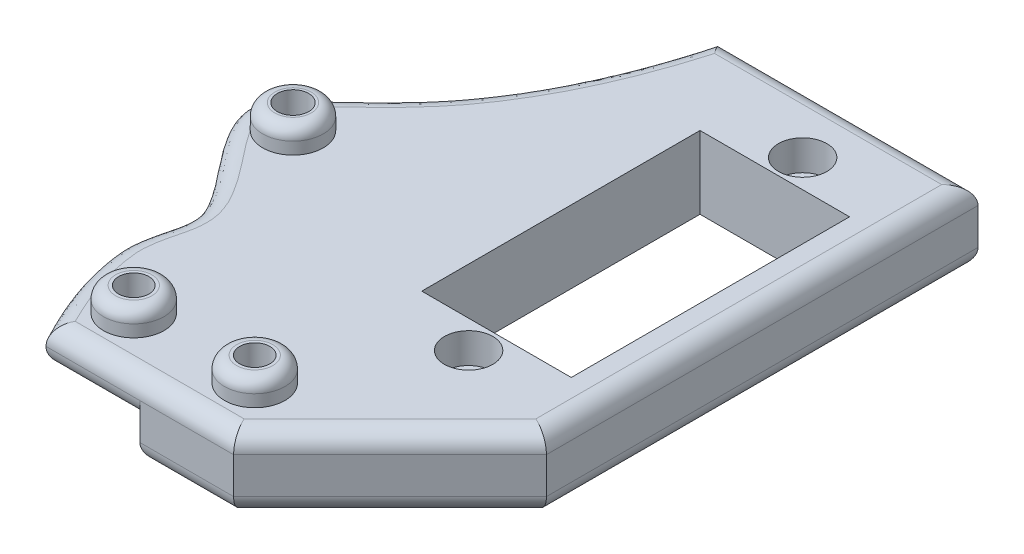
from build123d import *

# Parameters (mm, degrees)
BOSS_EXTRUDE1_DEPTH        = 3
SKETCH2_W                  = 12.36
SKETCH2_H                  = 23
CUT_EXTRUDE1_DEPTH         = 33.919797
F_2_6_2_6_DIAMETER_HOLE1_D = 2.6
F_2_0_2_DIAMETER_HOLE1_D   = 2
F_2_2_2_2_DIAMETER_HOLE1_D = 2.2
BOSS_EXTRUDE2_DEPTH        = 3
SKETCH11_W                 = 12.36
SKETCH11_H                 = 23
CUT_EXTRUDE2_DEPTH         = 34.327361
SKETCH12_R                 = 1
SKETCH12_R_2               = 1.1
CUT_EXTRUDE3_DEPTH         = 34.327361
SKETCH13_R                 = 2
CUT_EXTRUDE4_DEPTH         = 2.5
FILLET3_R                  = 1.5
SKETCH14_R                 = 1.25
CUT_EXTRUDE5_DEPTH         = 34.327361
BOSS_EXTRUDE3_START        = 2
SKETCH15_R                 = 2.5
SKETCH15_R_2               = 1.25
SKETCH15_R_3               = 1.3
BOSS_EXTRUDE3_DEPTH        = 2
FILLET4_R                  = 1


with BuildPart() as part:
    # Sketch1 → Boss-Extrude1 (new body)
    with BuildSketch(Plane.XZ.offset(3)):
        with BuildLine():
            Line((-0.726337, -25.437189), (20.68, -25.437189))
            Line((20.68, -25.437189), (20.68, 10.235728))
            Line((20.68, 10.235728), (7.753398, 23.162329))
            Line((7.753398, 23.162329), (-7.753398, 23.162329))
            add(Edge.make_bspline(
                [(-7.753398, 23.162329), (-9.182795, 20.429595), (-10.454447, 17.469115), (-10.710973, 14.395809), (-10.821792, 13.068149), (-10.474318, 11.730513), (-10.147929, 10.438835), (-10.004727, 9.872116), (-9.91883, 9.27062), (-9.998835, 8.691589), (-10.079694, 8.106376), (-10.325544, 7.544888), (-10.614698, 7.029716), (-11.64424, 5.195435), (-13.122267, 3.650604), (-14.312212, 1.91608), (-14.72158, 1.319364), (-15.112023, 0.698619), (-15.383083, 0.027665), (-15.505532, -0.275433), (-15.60346, -0.593593), (-15.642136, -0.918194), (-15.674344, -1.188511), (-15.662143, -1.468271), (-15.602679, -1.733926), (-15.543344, -1.999003), (-15.437422, -2.255311), (-15.30522, -2.492606), (-14.963033, -3.106812), (-14.460391, -3.624177), (-13.955605, -4.113598), (-11.676828, -6.323014), (-9.245108, -8.4256), (-7.349756, -10.971573), (-4.859981, -14.316017), (-3.034069, -18.183489), (-1.71459, -22.138645), (-1.351353, -23.227455), (-1.023408, -24.328497), (-0.726337, -25.437189)],
                knots=[0, 0, 0, 0, 0.009252, 0.009252, 0.009252, 0.013232, 0.013232, 0.013232, 0.014992, 0.014992, 0.014992, 0.016768, 0.016768, 0.016768, 0.023058, 0.023058, 0.023058, 0.025228, 0.025228, 0.025228, 0.026207, 0.026207, 0.026207, 0.027025, 0.027025, 0.027025, 0.027838, 0.027838, 0.027838, 0.02996, 0.02996, 0.02996, 0.039493, 0.039493, 0.039493, 0.052103, 0.052103, 0.052103, 0.055539, 0.055539, 0.055539, 0.055539], degree=3))
        make_face()
    extrude(amount=-BOSS_EXTRUDE1_DEPTH)

    # Sketch2 → Cut-Extrude1 (cut, through all)
    with BuildSketch(Plane(origin=(0, 0, 0), x_dir=(-1, 0, 0), z_dir=(0, 1, 0))):
        with Locations((-11.5, -6.32)):
            Rectangle(SKETCH2_W, SKETCH2_H)
    extrude(amount=-CUT_EXTRUDE1_DEPTH, mode=Mode.SUBTRACT)

    # Ø2.6 (2.6) Diameter Hole1 (through all)
    with Locations(Plane(origin=(0, 0, 0), x_dir=(1, 0, 0), z_dir=(0, 1, 0))):
        with Locations((-11.5, 1)):
            Hole(F_2_6_2_6_DIAMETER_HOLE1_D / 2)

    # Ø2.0 (2) Diameter Hole1 (through all)
    with Locations(Plane(origin=(0, 0, 0), x_dir=(1, 0, 0), z_dir=(0, 1, 0))):
        with Locations((-5, -18.662329), (5, -18.662329)):
            Hole(F_2_0_2_DIAMETER_HOLE1_D / 2)

    # Ø2.2 (2.2) Diameter Hole1 (through all)
    with Locations(Plane(origin=(0, 0, 0), x_dir=(1, 0, 0), z_dir=(0, 1, 0))):
        with Locations((11.5, -7.485), (11.5, 20.125)):
            Hole(F_2_2_2_2_DIAMETER_HOLE1_D / 2)

    # Sketch9 → Boss-Extrude2 (add)
    with BuildSketch(Plane.XZ.offset(3)):
        Polygon((0, 23.162329), (0, -25.437189), (20.68, -25.437189), (20.68, 10.235728), (7.753398, 23.162329), align=None)
    extrude(amount=BOSS_EXTRUDE2_DEPTH)

    # Sketch11 → Cut-Extrude2 (cut, through all)
    with BuildSketch(Plane(origin=(0, 0, 0), x_dir=(1, 0, 0), z_dir=(0, 1, 0))):
        with Locations((11.5, 6.32)):
            Rectangle(SKETCH11_W, SKETCH11_H)
    extrude(amount=-CUT_EXTRUDE2_DEPTH, mode=Mode.SUBTRACT)

    # Sketch12 → Cut-Extrude3 (cut, through all)
    with BuildSketch(Plane(origin=(0, 0, 0), x_dir=(1, 0, 0), z_dir=(0, 1, 0))):
        with Locations(Location((5, -18.662329, 0), (0, 0, 270))):
            Circle(SKETCH12_R)
        with Locations(Location((11.5, -7.485, 0), (0, 0, 270))):
            Circle(SKETCH12_R_2)
        with Locations(Location((11.5, 20.125, 0), (0, 0, 270))):
            Circle(SKETCH12_R_2)
    extrude(amount=-CUT_EXTRUDE3_DEPTH, mode=Mode.SUBTRACT)

    # Sketch13 → Cut-Extrude4 (cut)
    with BuildSketch(Plane(origin=(0, 0, 0), x_dir=(1, 0, 0), z_dir=(0, 1, 0))):
        with Locations(Location((11.5, -7.485, 0), (0, 0, 270))):
            Circle(SKETCH13_R)
        with Locations(Location((11.5, 20.125, 0), (0, 0, 270))):
            Circle(SKETCH13_R)
    extrude(amount=-CUT_EXTRUDE4_DEPTH, mode=Mode.SUBTRACT)

    # Fillet3
    fillet3_edges = [part.edges().sort_by_distance(p)[0] for p in [
        (9.976831, 0, -25.437189),
        (10.34, -6, -25.437189),
        (-15.337971, -3, -2.432404),
        (-15.337971, 0, -2.432404),
        (20.68, 0, -7.600731),
        (0, 0, 23.162329),
        (14.216699, 0, 16.699029),
        (20.68, -6, -7.600731),
        (0, -6, -1.13743),
        (3.876699, -6, 23.162329),
        (14.216699, -6, 16.699029),
        (-3.876699, -3, 23.162329),
    ]]
    fillet(fillet3_edges, radius=FILLET3_R - 0.0001)  # a hair under: the kernel refuses the full size

    # Sketch14 → Cut-Extrude5 (cut, through all)
    with BuildSketch(Plane(origin=(0, 0, 0), x_dir=(1, 0, 0), z_dir=(0, 1, 0))):
        with Locations(Location((5, -18.662329, 0), (0, 0, 270))):
            Circle(SKETCH14_R)
        with Locations(Location((-5, -18.662329, 0), (0, 0, 270))):
            Circle(SKETCH14_R)
    extrude(amount=-CUT_EXTRUDE5_DEPTH, mode=Mode.SUBTRACT)

    # Sketch15 → Boss-Extrude3 (add)
    # profile 1 of 3: a face of its own
    with BuildSketch(Plane(origin=(0, 0, 0), x_dir=(1, 0, 0), z_dir=(0, 1, 0)).offset(BOSS_EXTRUDE3_START)):
        with Locations(Location((5, -18.662329, 0), (0, 0, 270))):
            Circle(SKETCH15_R)
        with Locations(Location((5, -18.662329, 0), (0, 0, 270))):
            Circle(SKETCH15_R_2, mode=Mode.SUBTRACT)
    # profile 2 of 3: a face of its own
    with BuildSketch(Plane(origin=(0, 0, 0), x_dir=(1, 0, 0), z_dir=(0, 1, 0)).offset(BOSS_EXTRUDE3_START)):
        with Locations(Location((-5, -18.662329, 0), (0, 0, 270))):
            Circle(SKETCH15_R)
        with Locations(Location((-5, -18.662329, 0), (0, 0, 270))):
            Circle(SKETCH15_R_2, mode=Mode.SUBTRACT)
    # profile 3 of 3: a face of its own
    with BuildSketch(Plane(origin=(0, 0, 0), x_dir=(1, 0, 0), z_dir=(0, 1, 0)).offset(BOSS_EXTRUDE3_START)):
        with Locations(Location((-11.5, 1, 0), (0, 0, 122.03626))):
            Circle(SKETCH15_R)
        with Locations(Location((-11.5, 1, 0), (0, 0, 270))):
            Circle(SKETCH15_R_3, mode=Mode.SUBTRACT)
    extrude(amount=-BOSS_EXTRUDE3_DEPTH)

    # Fillet4
    fillet4_edges = [part.edges().sort_by_distance(p)[0] for p in [
        (5, 2, 16.162329),
        (-5, 2, 16.162329),
        (-10.17386, 2, 1.119281),
    ]]
    fillet(fillet4_edges, radius=FILLET4_R)


solid = part.part
